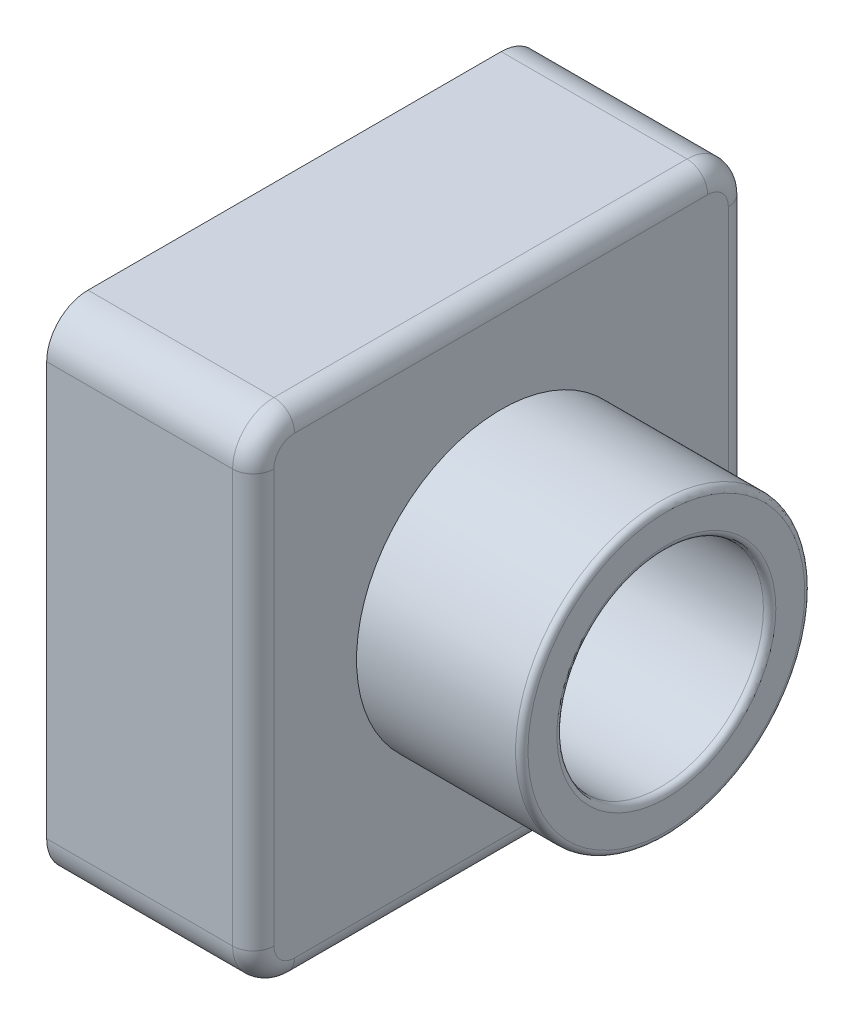
from build123d import *

# Parameters (mm, degrees)
SKETCH1_W               = 120
SKETCH1_H               = 120
BOSS_EXTRUDE1_DEPTH     = 50
SKETCH2_R               = 35
BOSS_EXTRUDE2_DEPTH     = 40
SKETCH4_R               = 25
CUT_EXTRUDE2_DEPTH      = 193.093727123
CUT_EXTRUDE1_DEPTH      = 193.093727123
CUT_EXTRUDE1_DEPTH_BACK = 193.093727123
SKETCH3_R               = 25
FILLET2_R               = 10
FILLET3_R               = 1.5
FILLET5_R               = 5
SHELL1_T                = -2


with BuildPart() as part:
    # Sketch1 → Boss-Extrude1 (new body)
    with BuildSketch(Plane(origin=(0, 0, 0), x_dir=(0, 0, -1), z_dir=(1, 0, 0))):
        with Locations((-60, 60)):
            Rectangle(SKETCH1_W, SKETCH1_H)
    extrude(amount=BOSS_EXTRUDE1_DEPTH)

    # Sketch3 → Cut-Extrude1 (cut, two sides: drawn at the far end of the back side and taken through both)
    with BuildSketch(Plane(origin=(90, 0, 0), x_dir=(0, 0, -1), z_dir=(1, 0, 0)).offset(-CUT_EXTRUDE1_DEPTH_BACK)):
        with Locations((-60, 60)):
            Circle(SKETCH3_R)
    extrude(amount=CUT_EXTRUDE1_DEPTH + CUT_EXTRUDE1_DEPTH_BACK, mode=Mode.SUBTRACT)

    # Fillet2
    fillet2_edges = [part.edges().sort_by_distance(p)[0] for p in [
        (25, 0, 0),
        (25, 0, 120),
        (25, 120, 120),
        (25, 120, 0),
    ]]
    fillet(fillet2_edges, radius=FILLET2_R)

    # Fillet5
    fillet5_edges = [part.edges().sort_by_distance(p)[0] for p in [
        (50, 2.928932188, 117.071067812),
        (50, 60, 120),
        (50, 117.071067812, 117.071067812),
        (50, 120, 60),
        (50, 117.071067812, 2.928932188),
        (50, 60, 0),
        (50, 2.928932188, 2.928932188),
        (50, 0, 60),
        (50, 60, 85),
    ]]
    fillet(fillet5_edges, radius=FILLET5_R)

    # Shell1
    shell1_openings = [part.faces().sort_by_distance(p)[0] for p in [
        (0, 1.697056275, 60),
    ]]
    offset(amount=SHELL1_T, openings=shell1_openings, kind=Kind.INTERSECTION)


with BuildPart() as body_2:
    # Sketch2 → Boss-Extrude2 (new body)
    with BuildSketch(Plane(origin=(50, 0, 0), x_dir=(0, 0, -1), z_dir=(1, 0, 0))):
        with Locations((-60, 60)):
            Circle(SKETCH2_R)
    extrude(amount=BOSS_EXTRUDE2_DEPTH)

    # Sketch4 → Cut-Extrude2 (cut, through all)
    with BuildSketch(Plane(origin=(90, 0, 0), x_dir=(0, 0, -1), z_dir=(1, 0, 0))):
        with Locations((-60, 60)):
            Circle(SKETCH4_R)
    extrude(amount=-CUT_EXTRUDE2_DEPTH, mode=Mode.SUBTRACT)

    # Fillet3
    fillet3_edges = [body_2.edges().sort_by_distance(p)[0] for p in [
        (90, 60, 95),
        (90, 60, 85),
    ]]
    fillet(fillet3_edges, radius=FILLET3_R)


solid = Compound([part.part, body_2.part])
